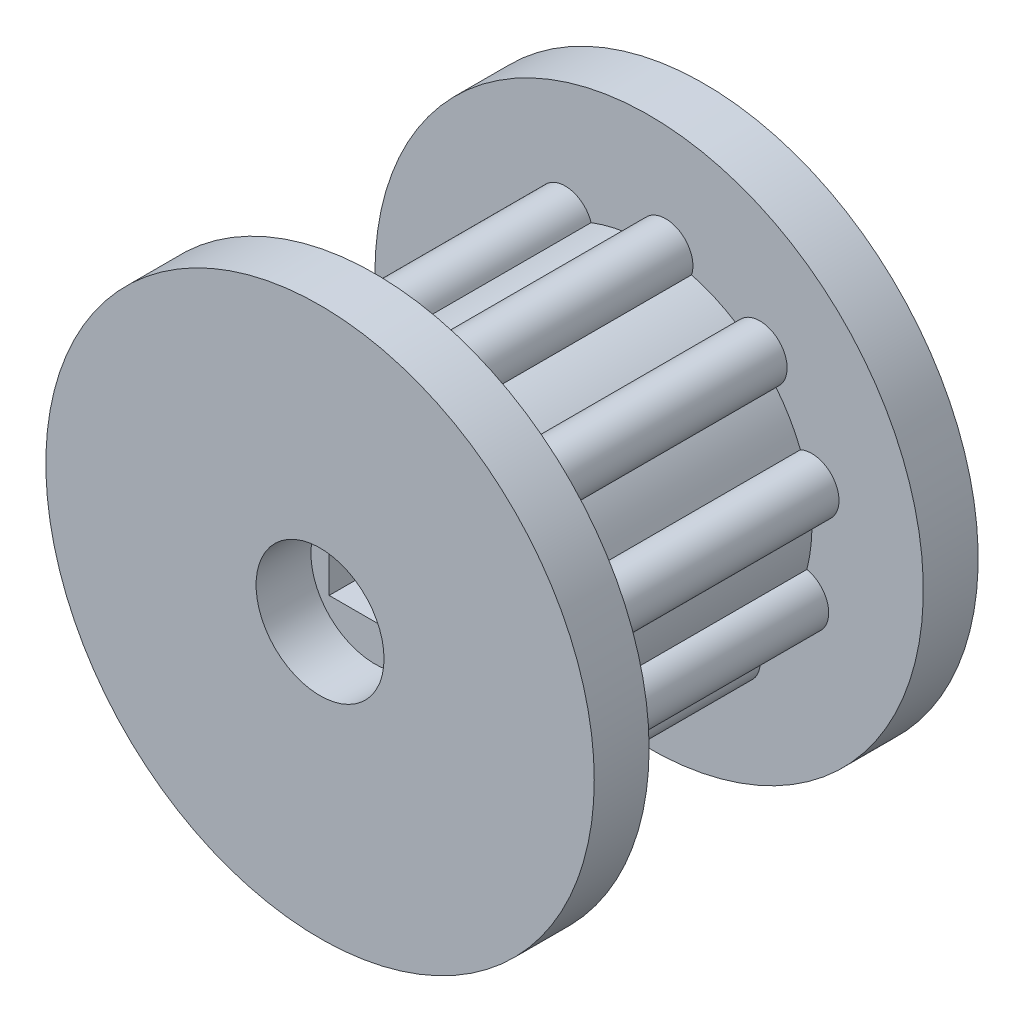
from build123d import *

# Parameters (mm, degrees)
SKETCH2_W           = 5
SKETCH2_H           = 3
BOSS_EXTRUDE1_DEPTH = 15
SKETCH3_R           = 15
SKETCH3_R_2         = 3.5
BOSS_EXTRUDE2_DEPTH = 3
BOSS_EXTRUDE3_START = 3
SKETCH4_R           = 15
SKETCH4_R_2         = 3.5
BOSS_EXTRUDE3_DEPTH = 3


# Read off the part's stored shape, not the designer's step: Pulley part01 GT2 6mm.STEP
with BuildPart() as part:
    # Sketch2 → Boss-Extrude1 (new body)
    with BuildSketch(Plane.XY.offset(5)):
        with BuildLine():
            ThreePointArc((6.934106351, 5.59049504), (7.051433078, 7.907185894), (4.763236954, 7.526422749))
            ThreePointArc((4.763236954, 7.526422749), (3.583838208, 8.154236284), (2.32379934, 8.598570946))
            ThreePointArc((2.32379934, 8.598570946), (1.057001937, 10.541776134), (-0.570380652, 8.888764346))
            ThreePointArc((-0.570380652, 8.888764346), (-1.893553819, 8.703442975), (-3.174120037, 8.322285003))
            ThreePointArc((-3.174120037, 8.322285003), (-5.341168017, 9.149766191), (-5.686132237, 6.855900077))
            ThreePointArc((-5.686132237, 6.855900077), (-6.647672646, 5.928230265), (-7.459633444, 4.86716905))
            ThreePointArc((-7.459633444, 4.86716905), (-9.699193326, 4.262856549), (-8.629974569, 2.204315))
            ThreePointArc((-8.629974569, 2.204315), (-8.862606466, 0.888635084), (-8.895820416, -0.447040053))
            ThreePointArc((-8.895820416, -0.447040053), (-10.352456447, -2.252319406), (-8.277459935, -3.289243485))
            ThreePointArc((-8.277459935, -3.289243485), (-7.692325842, -4.490388494), (-6.934106344, -5.590495048))
            ThreePointArc((-6.934106344, -5.590495048), (-7.05143307, -7.907185904), (-4.763236946, -7.526422754))
            ThreePointArc((-4.763236946, -7.526422754), (-3.583838199, -8.154236288), (-2.323799332, -8.598570948))
            ThreePointArc((-2.323799332, -8.598570948), (-1.057001929, -10.541776143), (0.570380658, -8.888764345))
            ThreePointArc((0.570380658, -8.888764345), (1.893553823, -8.703442974), (3.174120041, -8.322285002))
            ThreePointArc((3.174120041, -8.322285002), (5.341168023, -9.149766199), (5.686132236, -6.855900078))
            ThreePointArc((5.686132236, -6.855900078), (6.647672645, -5.928230266), (7.459633443, -4.867169052))
            ThreePointArc((7.459633443, -4.867169052), (9.699193332, -4.262856559), (8.629974567, -2.204315006))
            ThreePointArc((8.629974567, -2.204315006), (8.862606465, -0.888635092), (8.895820416, 0.447040044))
            ThreePointArc((8.895820416, 0.447040044), (10.352456454, 2.252319396), (8.277459939, 3.289243476))
            ThreePointArc((8.277459939, 3.289243476), (7.692325847, 4.490388485), (6.934106351, 5.59049504))
        make_face()
        Rectangle(SKETCH2_W, SKETCH2_H, mode=Mode.SUBTRACT)
    extrude(amount=BOSS_EXTRUDE1_DEPTH)

    # Sketch3 → Boss-Extrude2 (add)
    with BuildSketch(Plane(origin=(0, 0, 5), x_dir=(-1, 0, 0), z_dir=(0, 0, -1))):
        Circle(SKETCH3_R)
        Circle(SKETCH3_R_2, mode=Mode.SUBTRACT)
    extrude(amount=BOSS_EXTRUDE2_DEPTH)

    # Sketch4 → Boss-Extrude3 (add)
    with BuildSketch(Plane.XY.offset(20).offset(BOSS_EXTRUDE3_START)):
        with Locations(Location((0, 0, 0), (0, 0, 180))):
            Circle(SKETCH4_R)
        with Locations(Location((0, 0, 0), (0, 0, 180))):
            Circle(SKETCH4_R_2, mode=Mode.SUBTRACT)
    extrude(amount=-BOSS_EXTRUDE3_DEPTH)


solid = part.part
